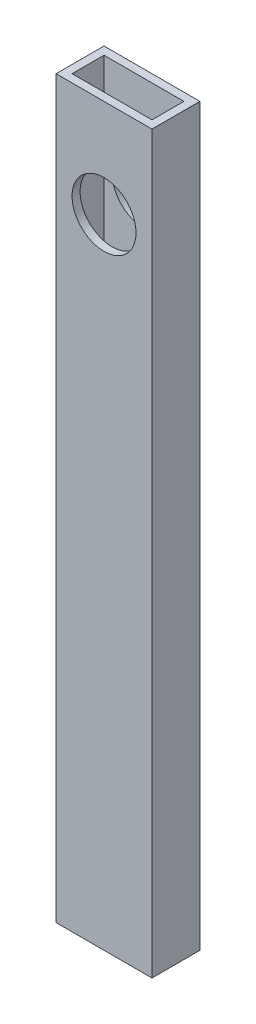
from build123d import *

# Parameters (mm, degrees)
SKETCH1_W           = 38.1
SKETCH1_H           = 19.05
SKETCH1_W_2         = 31.75
SKETCH1_H_2         = 12.7
BOSS_EXTRUDE1_DEPTH = 292.1
SKETCH2_R           = 12.7
CUT_EXTRUDE1_DEPTH  = 296.189638199


with BuildPart() as part:
    # Sketch1 → Boss-Extrude1 (new body)
    with BuildSketch(Plane(origin=(0, 0, 0), x_dir=(1, 0, 0), z_dir=(0, 1, 0))):
        with Locations((19.05, 9.525)):
            Rectangle(SKETCH1_W, SKETCH1_H)
        with Locations((19.05, 9.525)):
            Rectangle(SKETCH1_W_2, SKETCH1_H_2, mode=Mode.SUBTRACT)
    extrude(amount=BOSS_EXTRUDE1_DEPTH)

    # Sketch2 → Cut-Extrude1 (cut, through all)
    with BuildSketch(Plane.XY):
        with Locations((19.05, 253.185522473)):
            Circle(SKETCH2_R)
    extrude(amount=-CUT_EXTRUDE1_DEPTH, mode=Mode.SUBTRACT)


solid = part.part
